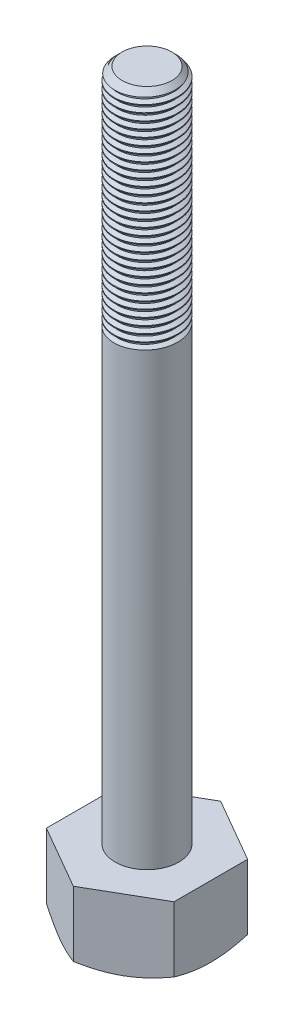
from build123d import *

# Parameters (mm, degrees)
SKETCH1_R           = 4.5
BOSS_EXTRUDE1_DEPTH = 10
SKETCH1_2_R         = 4.5
BOSS_EXTRUDE2_DEPTH = 105
CHAMFER1_SIZE       = 1
THREAD1_PITCH       = 1


with BuildPart() as part:
    # Sketch1 → Boss-Extrude1 (new body)
    with BuildSketch(Plane(origin=(0, 0, 0), x_dir=(1, 0, 0), z_dir=(0, 1, 0))):
        Polygon((9, -5.196152423), (9, 5.196152423), (0, 10.392304845), (-9, 5.196152423), (-9, -5.196152423), (0, -10.392304845), align=None)
        with Locations(Location((0, 0, 0), (0, 0, 270))):
            Circle(SKETCH1_R, mode=Mode.SUBTRACT)
    extrude(amount=BOSS_EXTRUDE1_DEPTH)

    # Sketch1<2> → Boss-Extrude2 (add)
    with BuildSketch(Plane(origin=(0, 0, 0), x_dir=(1, 0, 0), z_dir=(0, 1, 0))):
        with Locations(Location((0, 0, 0), (0, 0, 270))):
            Circle(SKETCH1_2_R)
    extrude(amount=BOSS_EXTRUDE2_DEPTH)

    # Sketch3 → Cut-Revolve1 (revolve, cut)
    with BuildSketch(Plane.XY):
        Polygon((9, 0), (15.46500298, 0), (15.46500298, 3.732571211), align=None)
    revolve(axis=Axis((0, 0, 0), (0, -1, 0)), mode=Mode.SUBTRACT)

    # Chamfer1
    chamfer1_edges = [part.edges().sort_by_distance(p)[0] for p in [
        (0, 105, -4.5),
    ]]
    chamfer(chamfer1_edges, length=CHAMFER1_SIZE)

    # Thread1: the profile of Thread Profile1 profile screwed along a right-hand helix of 32 turns, 8 arcs to a turn; built about Z, then put on its axis
    thread1_z = Axis((0, 0, 0), (0, 0, 1))
    thread1_corners = [(4.5003, 0, -0.000173205), (4.5003, 0, 0.875173202), (3.958734125, 0, 0.562499999), (3.958734125, 0, 0.312499999)]
    with BuildLine(mode=Mode.PRIVATE) as thread1_profile:
        Line(thread1_corners[0], thread1_corners[1])
        Line(thread1_corners[1], thread1_corners[2])
        Line(thread1_corners[2], thread1_corners[3])
        Line(thread1_corners[3], thread1_corners[0])
    thread1_cap = Face(thread1_profile.wire())
    thread1_turn_angles = [0, 22.5, 45, 67.5, 90, 112.5, 135, 157.5, 180, 202.5, 225, 247.5, 270, 292.5, 315, 337.5, 360]
    thread1_turn_weights = [1, 0.9238795325112867, 1, 0.9238795325112867, 1, 0.9238795325112867, 1, 0.9238795325112867, 1, 0.9238795325112867, 1, 0.9238795325112867, 1, 0.9238795325112867, 1, 0.9238795325112867, 1]
    thread1_turn_rails = [Edge.make_bspline([Vector(p[0], p[1], 0).rotate(thread1_z, thread1_turn_angles[k]) / thread1_turn_weights[k] + Vector(0, 0, p[2] + THREAD1_PITCH * thread1_turn_angles[k] / 360) for k in range(17)], [0, 0, 0, 1, 1, 2, 2, 3, 3, 4, 4, 5, 5, 6, 6, 7, 7, 8, 8, 8], 2, thread1_turn_weights) for p in thread1_corners]
    thread1_turn_sides = [Face.make_surface_from_curves(thread1_turn_rails[p[0]], thread1_turn_rails[p[1]]) for p in [(0, 1), (1, 2), (2, 3), (3, 0)]]
    thread1 = Plane(origin=(0, 106, 0), x_dir=(-1, 0, 0), z_dir=(0, -1, 0)) * Solid(Shell([*[p.moved(Location((0, 0, THREAD1_PITCH * i))) for i in range(32) for p in thread1_turn_sides], thread1_cap, thread1_cap.rotate(thread1_z, 11520).moved(Location((0, 0, THREAD1_PITCH * 11520 / 360)))]))
    add(thread1, mode=Mode.SUBTRACT)


solid = part.part
